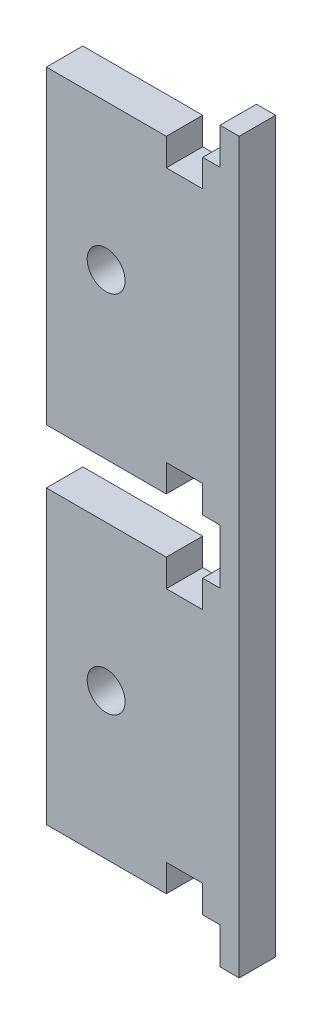
from build123d import *

# Parameters (mm, degrees)
SKETCH2_W               = 40.64
SKETCH2_H               = 127
BOSS_EXTRUDE1_DEPTH     = 6.35
M6_CLEARANCE_HOLE1_D    = 6.6
CUT_EXTRUDE1_DEPTH      = 134.495063954
CUT_EXTRUDE1_DEPTH_BACK = 134.495063954
SKETCH5_W               = 7.0505
SKETCH5_H               = 127
SKETCH6_W               = 30.25575
SKETCH6_H               = 6.35
SKETCH6_H_2             = 9.525
CUT_EXTRUDE2_DEPTH      = 134.495063954
SKETCH7_W               = 6.35
SKETCH7_H               = 4.7625
CUT_EXTRUDE3_DEPTH      = 134.495063954


with BuildPart() as part:
    # Sketch2 → Boss-Extrude1 (new body)
    with BuildSketch(Plane.XY):
        with Locations((20.32, 63.5)):
            Rectangle(SKETCH2_W, SKETCH2_H)
    extrude(amount=BOSS_EXTRUDE1_DEPTH)

    # M6 Clearance Hole1 (through all)
    with Locations(Plane.XY.offset(6.35)):
        with Locations((17.4625, 31.75), (17.4625, 95.25)):
            Hole(M6_CLEARANCE_HOLE1_D / 2)

    # Sketch5 → Cut-Extrude1 (cut, two sides: drawn at the far end of the back side and taken through both)
    with BuildSketch(Plane.XY.offset(6.35).offset(-CUT_EXTRUDE1_DEPTH_BACK)):
        with Locations((3.52525, 63.5)):
            Rectangle(SKETCH5_W, SKETCH5_H)
    extrude(amount=CUT_EXTRUDE1_DEPTH + CUT_EXTRUDE1_DEPTH_BACK, mode=Mode.SUBTRACT)

    # Sketch6 → Cut-Extrude2 (cut, through all)
    with BuildSketch(Plane.XY.offset(6.35)):
        with Locations((22.178375, 123.825)):
            Rectangle(SKETCH6_W, SKETCH6_H)
        with Locations((22.178375, 61.9125)):
            Rectangle(SKETCH6_W, SKETCH6_H_2)
        with Locations((22.178375, 3.175)):
            Rectangle(SKETCH6_W, SKETCH6_H)
    extrude(amount=-CUT_EXTRUDE2_DEPTH, mode=Mode.SUBTRACT)

    # Sketch7 → Cut-Extrude3 (cut, through all)
    with BuildSketch(Plane.XY.offset(6.35)):
        with Locations((31.115, 118.26875)):
            Rectangle(SKETCH7_W, SKETCH7_H)
        with Locations((31.115, 69.05625)):
            Rectangle(SKETCH7_W, SKETCH7_H)
        with Locations((31.115, 54.76875)):
            Rectangle(SKETCH7_W, SKETCH7_H)
        with Locations((31.115, 8.73125)):
            Rectangle(SKETCH7_W, SKETCH7_H)
    extrude(amount=-CUT_EXTRUDE3_DEPTH, mode=Mode.SUBTRACT)


solid = part.part
